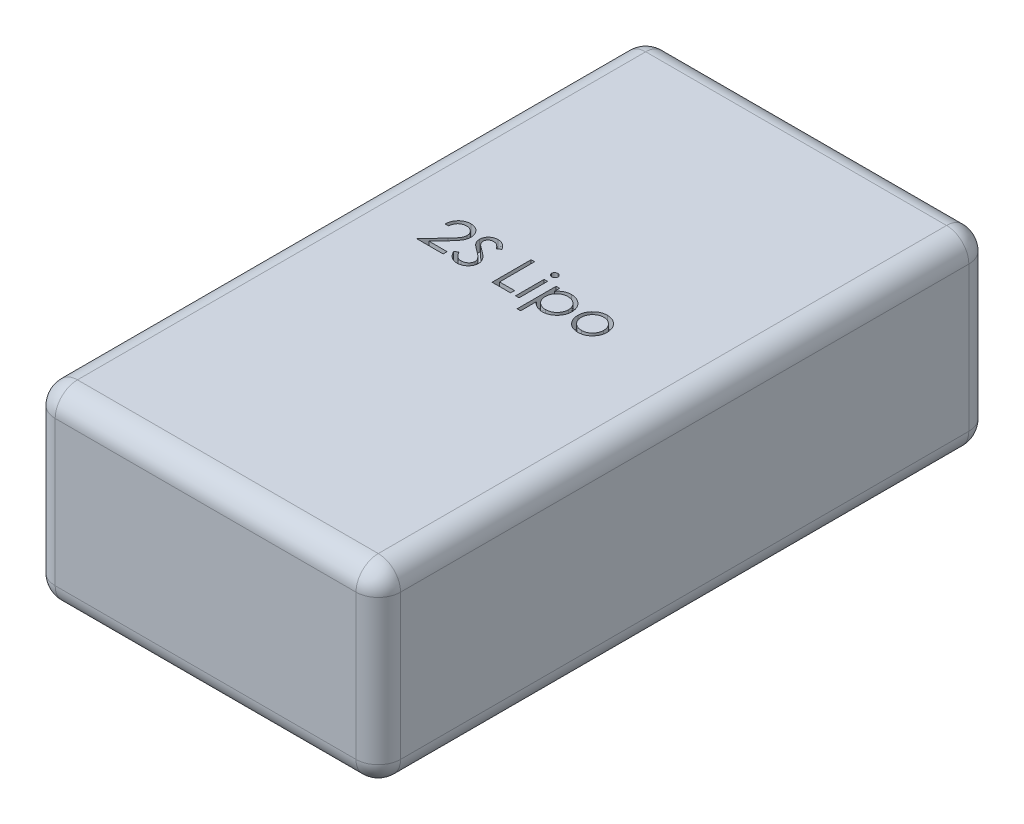
from build123d import *

# Parameters (mm, degrees)
SKETCH1_W           = 31
SKETCH1_H           = 55
BOSS_EXTRUDE1_DEPTH = 17
SKETCH2_W           = 0.314102564
SKETCH2_H           = 2.557692308
CUT_EXTRUDE1_DEPTH  = 1
FILLET1_R           = 2


with BuildPart() as part:
    # Sketch1 → Boss-Extrude1 (new body)
    with BuildSketch(Plane(origin=(0, 0, 0), x_dir=(1, 0, 0), z_dir=(0, 1, 0))):
        with Locations((15.5, -27.5)):
            Rectangle(SKETCH1_W, SKETCH1_H)
    extrude(amount=BOSS_EXTRUDE1_DEPTH)

    # Sketch2 → Cut-Extrude1 (cut)
    # profile 1 of 7: a face of its own
    with BuildSketch(Plane(origin=(0, 17, 0), x_dir=(1, 0, 0), z_dir=(0, 1, 0))):
        with BuildLine():
            Line((6.692234496, -24.382132974), (6.378131932, -24.382132974))
            add(Edge.make_bspline(
                [(6.378131932, -24.382132974), (6.380179085, -24.340462086), (6.384199639, -24.258621572), (6.403027928, -24.139297665), (6.429968806, -24.025242866), (6.46806026, -23.917372952), (6.515366537, -23.814734145), (6.572096565, -23.71773413), (6.639290415, -23.626742941), (6.715497149, -23.542604098), (6.798265788, -23.465416527), (6.887571728, -23.398761284), (6.981416755, -23.342443613), (7.079516154, -23.295362371), (7.182976718, -23.260022525), (7.290859576, -23.233800885), (7.403638712, -23.218024539), (7.480478734, -23.216328754), (7.519558214, -23.215466307)],
                knots=[0, 0, 0, 0, 1.10065271, 2.161652631, 3.183658789, 4.190468796, 5.17591951, 6.163126047, 7.15150782, 8.156236427, 9.156009102, 10.134482811, 11.092018607, 12.041330605, 13.001268258, 13.972401359, 14.968799086, 16, 16, 16, 16], degree=3))
            add(Edge.make_bspline(
                [(7.519558214, -23.215466307), (7.557936288, -23.216364764), (7.633347833, -23.218130198), (7.743409847, -23.233291228), (7.848187142, -23.257036819), (7.947474908, -23.290352236), (8.040480973, -23.335136663), (8.127904017, -23.388934202), (8.210784828, -23.451154033), (8.285391612, -23.524407847), (8.353899691, -23.602610231), (8.413001946, -23.686098135), (8.46361511, -23.77232742), (8.50580279, -23.861955622), (8.536858929, -23.95582665), (8.560437137, -24.052573853), (8.57376455, -24.153198664), (8.575809974, -24.22130522), (8.576849881, -24.255931051)],
                knots=[0, 0, 0, 0, 1.111607364, 2.184268762, 3.212621178, 4.221274766, 5.211760367, 6.196651075, 7.1921475, 8.207485113, 9.220403448, 10.201281604, 11.166441695, 12.114753415, 13.065576456, 14.026450734, 14.996634279, 16, 16, 16, 16], degree=3))
            add(Edge.make_bspline(
                [(8.576849881, -24.255931051), (8.575156618, -24.304678885), (8.571799807, -24.401319099), (8.54308543, -24.543333962), (8.498238919, -24.680927381), (8.444241562, -24.791664683), (8.389769118, -24.880898177), (8.34068161, -24.954366882), (8.283216799, -25.03347235), (8.216538301, -25.117949687), (8.142025429, -25.208460593), (8.059003266, -25.304950388), (7.966879784, -25.406422158), (7.902221283, -25.475727759), (7.868716868, -25.511640185)],
                knots=[0, 0, 0, 0, 1.184426356, 2.348067706, 3.509069118, 4.696110526, 5.333549288, 6.050745305, 6.844228056, 7.710549037, 8.667450064, 9.695053472, 10.805634456, 12, 12, 12, 12], degree=3))
            Line((7.868716868, -25.511640185), (6.993015746, -26.446235538))
            Line((6.993015746, -26.446235538), (8.621721676, -26.446235538))
            Line((8.621721676, -26.446235538), (8.621721676, -26.805209897))
            Line((8.621721676, -26.805209897), (6.243516548, -26.805209897))
            Line((6.243516548, -26.805209897), (7.600888342, -25.356692269))
            add(Edge.make_bspline(
                [(7.600888342, -25.356692269), (7.633936229, -25.322193962), (7.697414456, -25.255929776), (7.787197033, -25.159186815), (7.867836021, -25.069437275), (7.939853414, -24.986850726), (8.00168692, -24.910219158), (8.056559152, -24.842024455), (8.100524742, -24.779270005), (8.148240138, -24.706529391), (8.19445412, -24.617717073), (8.234166476, -24.509183384), (8.258381324, -24.397456132), (8.26128616, -24.321954095), (8.262747317, -24.283975923)],
                knots=[0, 0, 0, 0, 1.329631726, 2.553950428, 3.673215718, 4.687767853, 5.603093632, 6.413772471, 7.123043292, 7.734684054, 8.834405432, 9.900288307, 10.943827018, 12, 12, 12, 12], degree=3))
            add(Edge.make_bspline(
                [(8.262747317, -24.283975923), (8.262111574, -24.260094524), (8.260858648, -24.213028874), (8.249800951, -24.144023115), (8.233090445, -24.077458301), (8.209145187, -24.013129682), (8.177538447, -23.95168403), (8.139065067, -23.89304655), (8.094675003, -23.836357584), (8.043323734, -23.783204286), (7.986912214, -23.734523081), (7.927317965, -23.691398995), (7.86426786, -23.655359885), (7.798027738, -23.625816387), (7.728782269, -23.602641006), (7.656397524, -23.586582427), (7.581073507, -23.576499943), (7.529640012, -23.575135771), (7.503432413, -23.574440666)],
                knots=[0, 0, 0, 0, 0.991446411, 1.95395049, 2.89581595, 3.838931463, 4.798493298, 5.75982156, 6.748411868, 7.785213223, 8.824556874, 9.840280684, 10.836137867, 11.835679398, 12.848801643, 13.863922112, 14.911575587, 16, 16, 16, 16], degree=3))
            add(Edge.make_bspline(
                [(7.503432413, -23.574440666), (7.47606158, -23.575155698), (7.422309784, -23.576559904), (7.343390751, -23.586382568), (7.268104973, -23.603328408), (7.196263071, -23.626505083), (7.127743485, -23.655963631), (7.062879441, -23.692655376), (7.001816551, -23.736438869), (6.944440028, -23.786079426), (6.891576049, -23.841347027), (6.845129173, -23.90295699), (6.804545159, -23.969784405), (6.769135925, -24.041648956), (6.740380235, -24.119202736), (6.718407085, -24.202170441), (6.701020238, -24.290191822), (6.695211718, -24.350976907), (6.692234496, -24.382132974)],
                knots=[0, 0, 0, 0, 1.031018746, 2.02475058, 2.990194455, 3.934040569, 4.864654155, 5.795059489, 6.735614925, 7.690564532, 8.649604399, 9.611025574, 10.590972636, 11.591080095, 12.624614302, 13.701020113, 14.821632451, 16, 16, 16, 16], degree=3))
        make_face()
    # profile 2 of 7: a face of its own
    with BuildSketch(Plane(origin=(0, 17, 0), x_dir=(1, 0, 0), z_dir=(0, 1, 0))):
        with BuildLine():
            Line((8.890952445, -26.130029609), (9.186825842, -25.952645794))
            add(Edge.make_bspline(
                [(9.186825842, -25.952645794), (9.21434408, -25.998710179), (9.26706796, -26.086967763), (9.355019319, -26.206225804), (9.446152231, -26.30758796), (9.541141564, -26.390464568), (9.639407512, -26.455713455), (9.741591566, -26.501915686), (9.847349377, -26.530731662), (9.919323198, -26.534231748), (9.95525533, -26.535979128)],
                knots=[0, 0, 0, 0, 1.272034388, 2.437168799, 3.508375237, 4.49857839, 5.41946034, 6.295179144, 7.148887113, 8, 8, 8, 8], degree=3))
            add(Edge.make_bspline(
                [(9.95525533, -26.535979128), (9.98594219, -26.535124455), (10.046778963, -26.533430065), (10.136341206, -26.517149263), (10.223323008, -26.492137134), (10.305931646, -26.456316202), (10.383027261, -26.412977717), (10.450633956, -26.360631539), (10.509080069, -26.302025334), (10.556889184, -26.236642679), (10.593569219, -26.16632553), (10.621761287, -26.094149579), (10.637406361, -26.018981011), (10.639763115, -25.968370548), (10.640952445, -25.942830089)],
                knots=[0, 0, 0, 0, 1.095163259, 2.171163733, 3.241058638, 4.321873601, 5.38011039, 6.391990106, 7.366004449, 8.327778327, 9.272591725, 10.192022065, 11.087607919, 12, 12, 12, 12], degree=3))
            add(Edge.make_bspline(
                [(10.640952445, -25.942830089), (10.639478134, -25.91368924), (10.636481076, -25.85445015), (10.611149596, -25.767050497), (10.571300349, -25.680557927), (10.534537705, -25.627056662), (10.515451644, -25.59928041)],
                knots=[0, 0, 0, 0, 0.938893495, 1.908633276, 2.914225137, 4, 4, 4, 4], degree=3))
            add(Edge.make_bspline(
                [(10.515451644, -25.59928041), (10.499781029, -25.579233586), (10.466882535, -25.537147788), (10.410325023, -25.474502552), (10.343958908, -25.409884133), (10.270055353, -25.340825076), (10.185922265, -25.27053728), (10.09419475, -25.195669002), (9.992530891, -25.119067425), (9.921231395, -25.067694859), (9.884442028, -25.041187461)],
                knots=[0, 0, 0, 0, 0.722233717, 1.516239348, 2.393582979, 3.351407094, 4.387010283, 5.505090956, 6.712668013, 8, 8, 8, 8], degree=3))
            add(Edge.make_bspline(
                [(9.884442028, -25.041187461), (9.847618032, -25.014958873), (9.777213356, -24.964811811), (9.678754773, -24.890387527), (9.59071031, -24.822343658), (9.513471294, -24.760039646), (9.447071697, -24.703467041), (9.390988286, -24.653169102), (9.346649729, -24.607785541), (9.321994148, -24.578344199), (9.3109244, -24.565125762)],
                knots=[0, 0, 0, 0, 1.452282411, 2.77665338, 3.964542531, 5.026858415, 5.96415736, 6.766646006, 7.446254459, 8, 8, 8, 8], degree=3))
            add(Edge.make_bspline(
                [(9.3109244, -24.565125762), (9.295451855, -24.544524725), (9.265023018, -24.504010022), (9.224857013, -24.440685164), (9.19071785, -24.375861899), (9.163955518, -24.309366034), (9.141419299, -24.242131105), (9.126261368, -24.173279859), (9.116769971, -24.103121241), (9.115797985, -24.05590774), (9.115311419, -24.032273198)],
                knots=[0, 0, 0, 0, 1.068054152, 2.10047183, 3.106115577, 4.101338837, 5.06977816, 6.043150881, 7.020423561, 8, 8, 8, 8], degree=3))
            add(Edge.make_bspline(
                [(9.115311419, -24.032273198), (9.116616628, -23.995243424), (9.119199148, -23.92197536), (9.141039666, -23.81494453), (9.175512559, -23.712758112), (9.223807447, -23.616427779), (9.2860648, -23.528461798), (9.358110774, -23.447848311), (9.443922261, -23.380079728), (9.538074884, -23.32086767), (9.641131256, -23.274521745), (9.749122159, -23.239560765), (9.862219231, -23.219751507), (9.938822366, -23.216908742), (9.977691227, -23.215466307)],
                knots=[0, 0, 0, 0, 1.005424448, 1.989358655, 2.955360095, 3.929531133, 4.905563448, 5.876582895, 6.856512386, 7.866279853, 8.892233794, 9.918561126, 10.94386622, 12, 12, 12, 12], degree=3))
            add(Edge.make_bspline(
                [(9.977691227, -23.215466307), (10.018935327, -23.216888859), (10.100956679, -23.21971786), (10.221605895, -23.244315391), (10.337766611, -23.285016063), (10.431209876, -23.331204721), (10.504342637, -23.377336137), (10.56011537, -23.419355961), (10.616632821, -23.46773107), (10.674350876, -23.522590316), (10.732291535, -23.584437067), (10.791314987, -23.652847756), (10.851559256, -23.727404312), (10.890315116, -23.780628812), (10.910183214, -23.807914224)],
                knots=[0, 0, 0, 0, 1.286793592, 2.559021753, 3.825965368, 5.121522368, 5.803751409, 6.523245864, 7.299691795, 8.125521123, 9.008227632, 9.944561021, 10.946284179, 12, 12, 12, 12], degree=3))
            Line((10.910183214, -23.807914224), (10.626228887, -24.023158615))
            add(Edge.make_bspline(
                [(10.626228887, -24.023158615), (10.609082955, -24.001069924), (10.576063898, -23.958532271), (10.525934411, -23.898960956), (10.478685763, -23.844544476), (10.432135363, -23.797279348), (10.388741732, -23.754577215), (10.346624689, -23.718017458), (10.306390338, -23.687241863), (10.255673428, -23.654398303), (10.191955709, -23.621841799), (10.111971173, -23.594292721), (10.028384898, -23.577737659), (9.971455266, -23.575548771), (9.942635137, -23.574440666)],
                knots=[0, 0, 0, 0, 1.181633172, 2.275549214, 3.290209073, 4.226197932, 5.078386478, 5.862611352, 6.581680152, 7.217281963, 8.414376989, 9.595101626, 10.782541182, 12, 12, 12, 12], degree=3))
            add(Edge.make_bspline(
                [(9.942635137, -23.574440666), (9.906478615, -23.575652366), (9.836754167, -23.577989015), (9.737763931, -23.603509001), (9.648670006, -23.643690861), (9.572117441, -23.700005839), (9.508380464, -23.766726832), (9.462275005, -23.843505687), (9.434524841, -23.928288089), (9.431138561, -23.987429746), (9.429413983, -24.017549641)],
                knots=[0, 0, 0, 0, 1.14458467, 2.207223713, 3.21896685, 4.227309161, 5.202851033, 6.127160689, 7.046193047, 8, 8, 8, 8], degree=3))
            add(Edge.make_bspline(
                [(9.429413983, -24.017549641), (9.42980711, -24.036301119), (9.430594006, -24.073834739), (9.441568804, -24.12928616), (9.455668133, -24.1845975), (9.478010765, -24.239520083), (9.508856068, -24.295014442), (9.549361244, -24.352036179), (9.600374556, -24.411087888), (9.639451568, -24.449495262), (9.660083054, -24.469773198)],
                knots=[0, 0, 0, 0, 0.858281714, 1.717966888, 2.583508476, 3.4729293, 4.427298488, 5.488583878, 6.674047936, 8, 8, 8, 8], degree=3))
            add(Edge.make_bspline(
                [(9.660083054, -24.469773198), (9.667744426, -24.476610224), (9.685946093, -24.492853432), (9.719222019, -24.519445713), (9.763164817, -24.552248485), (9.816627019, -24.592835802), (9.88059438, -24.639917264), (9.955073936, -24.692890876), (10.039235469, -24.753476335), (10.098957385, -24.795833876), (10.130535778, -24.81823073)],
                knots=[0, 0, 0, 0, 0.420754252, 0.999615792, 1.744751191, 2.668019286, 3.750313428, 4.999500688, 6.413464383, 8, 8, 8, 8], degree=3))
            add(Edge.make_bspline(
                [(10.130535778, -24.81823073), (10.168521692, -24.84587209), (10.242076148, -24.899395752), (10.346733728, -24.979811432), (10.441627536, -25.0584592), (10.52709074, -25.134836807), (10.603967648, -25.2083649), (10.671405369, -25.279928081), (10.730091049, -25.349013653), (10.793270267, -25.437586229), (10.857828087, -25.546367313), (10.913269594, -25.679645552), (10.948227942, -25.813441872), (10.952799457, -25.903368709), (10.955055009, -25.947737942)],
                knots=[0, 0, 0, 0, 1.163667725, 2.253281268, 3.268753668, 4.215851969, 5.092017293, 5.902905408, 6.650798638, 7.335211899, 8.59617414, 9.77448103, 10.901945474, 12, 12, 12, 12], degree=3))
            add(Edge.make_bspline(
                [(10.955055009, -25.947737942), (10.954397871, -25.979116307), (10.953096356, -26.04126369), (10.938135442, -26.132518767), (10.916215777, -26.221149637), (10.883178543, -26.306060749), (10.842855385, -26.388805512), (10.791689137, -26.467213413), (10.732381452, -26.543019811), (10.664347687, -26.614203303), (10.589901785, -26.679549499), (10.51121809, -26.73767856), (10.428167817, -26.786146883), (10.341201501, -26.825697725), (10.250299164, -26.856631243), (10.15549138, -26.879044112), (10.056621869, -26.892799823), (9.989421387, -26.894227584), (9.95525533, -26.894953487)],
                knots=[0, 0, 0, 0, 0.983748083, 1.948392443, 2.894712957, 3.844097841, 4.80183111, 5.778335162, 6.776009319, 7.81870978, 8.863265674, 9.881300176, 10.883814829, 11.87499822, 12.874611388, 13.892143829, 14.928324115, 16, 16, 16, 16], degree=3))
            add(Edge.make_bspline(
                [(9.95525533, -26.894953487), (9.928819987, -26.894442305), (9.876282227, -26.89342638), (9.798572745, -26.884445099), (9.722433155, -26.871737996), (9.648818873, -26.851563926), (9.576781462, -26.827086949), (9.506634227, -26.796948616), (9.438343173, -26.760831415), (9.371525591, -26.71953639), (9.306351416, -26.671478645), (9.243431948, -26.615505149), (9.180702762, -26.553159644), (9.120015366, -26.482749081), (9.060142222, -26.405410998), (9.002263812, -26.320421814), (8.945182095, -26.228244461), (8.909366627, -26.163379375), (8.890952445, -26.130029609)],
                knots=[0, 0, 0, 0, 0.915332311, 1.819136955, 2.706846663, 3.586547465, 4.459518054, 5.340707479, 6.227863349, 7.133153174, 8.059268498, 9.028702269, 10.047606654, 11.120612155, 12.245963614, 13.433783089, 14.680604001, 16, 16, 16, 16], degree=3))
        make_face()
    # profile 3 of 7: a face of its own
    with BuildSketch(Plane(origin=(0, 17, 0), x_dir=(1, 0, 0), z_dir=(0, 1, 0))):
        Polygon((13.019157573, -23.305209897), (13.333260137, -23.305209897), (13.333260137, -26.446235538), (14.679413983, -26.446235538), (14.679413983, -26.805209897), (13.019157573, -26.805209897), align=None)
    # profile 4 of 7: a face of its own
    with BuildSketch(Plane(origin=(0, 17, 0), x_dir=(1, 0, 0), z_dir=(0, 1, 0))):
        with BuildLine():
            add(Edge.make_bspline(
                [(15.283780971, -23.170594512), (15.303272286, -23.171498665), (15.341440026, -23.173269169), (15.396633294, -23.188430646), (15.446890306, -23.214130331), (15.491468039, -23.248610012), (15.529719926, -23.289159456), (15.556500636, -23.336420424), (15.573713032, -23.387479063), (15.575791587, -23.423094152), (15.576849881, -23.441227525)],
                knots=[0, 0, 0, 0, 1.055194115, 2.066272739, 3.074728998, 4.095836921, 5.109056067, 6.073838105, 7.019297344, 8, 8, 8, 8], degree=3))
            add(Edge.make_bspline(
                [(15.576849881, -23.441227525), (15.575767721, -23.458890178), (15.573628419, -23.493807153), (15.556513931, -23.543980625), (15.529491693, -23.590584909), (15.491492567, -23.631055619), (15.446883806, -23.665516239), (15.396635021, -23.691220978), (15.341439572, -23.706381115), (15.303272133, -23.708151804), (15.283780971, -23.709056051)],
                knots=[0, 0, 0, 0, 0.96129708, 1.900370562, 2.859976407, 3.87933698, 4.906634145, 5.921202961, 6.938410037, 8, 8, 8, 8], degree=3))
            add(Edge.make_bspline(
                [(15.283780971, -23.709056051), (15.264512695, -23.708186331), (15.227009515, -23.706493534), (15.172642673, -23.690923516), (15.122814184, -23.665507443), (15.078149511, -23.631281258), (15.040919318, -23.590336361), (15.013820992, -23.544009067), (14.99674603, -23.493799912), (14.994601402, -23.458887746), (14.993516548, -23.441227525)],
                knots=[0, 0, 0, 0, 1.054934014, 2.053291228, 3.073705704, 4.106921865, 5.123545215, 6.088680038, 7.033164197, 8, 8, 8, 8], degree=3))
            add(Edge.make_bspline(
                [(14.993516548, -23.441227525), (14.994577634, -23.423096676), (14.996661675, -23.387486543), (15.013833791, -23.33639151), (15.040693599, -23.289410008), (15.078174163, -23.248384509), (15.122807623, -23.214139074), (15.172644368, -23.188728093), (15.227009067, -23.173156753), (15.264512543, -23.171464139), (15.283780971, -23.170594512)],
                knots=[0, 0, 0, 0, 0.98631895, 1.937192651, 2.907499808, 3.917963147, 4.944918757, 5.95915025, 6.951458133, 8, 8, 8, 8], degree=3))
        make_face()
    # profile 5 of 7: a face of its own
    with BuildSketch(Plane(origin=(0, 17, 0), x_dir=(1, 0, 0), z_dir=(0, 1, 0))):
        with Locations((15.285183214, -25.526363743)):
            Rectangle(SKETCH2_W, SKETCH2_H)
    # profile 6 of 7: a face of its own
    with BuildSketch(Plane(origin=(0, 17, 0), x_dir=(1, 0, 0), z_dir=(0, 1, 0))):
        with BuildLine():
            Line((16.205055009, -24.247517589), (16.519157573, -24.247517589))
            Line((16.519157573, -24.247517589), (16.519157573, -24.720774801))
            add(Edge.make_bspline(
                [(16.519157573, -24.720774801), (16.552515057, -24.677837067), (16.617338652, -24.594396174), (16.729063557, -24.486406045), (16.846990366, -24.395330742), (16.974153778, -24.323948209), (17.108577468, -24.270127397), (17.249709786, -24.230347947), (17.398748551, -24.206906472), (17.500645003, -24.204084811), (17.552611099, -24.202645794)],
                knots=[0, 0, 0, 0, 1.0828784, 2.104357462, 3.088488658, 4.04616522, 5.001424249, 5.969181776, 6.964304535, 8, 8, 8, 8], degree=3))
            add(Edge.make_bspline(
                [(17.552611099, -24.202645794), (17.598002702, -24.203958973), (17.68772159, -24.20655454), (17.819784819, -24.224127595), (17.946960203, -24.254245287), (18.068528257, -24.297646203), (18.185791322, -24.351301673), (18.297013422, -24.419018708), (18.403926977, -24.497424899), (18.503843166, -24.58765705), (18.596164534, -24.685285316), (18.676010715, -24.79030762), (18.744882619, -24.899270207), (18.800552916, -25.013862299), (18.844161263, -25.133181529), (18.875175941, -25.25770997), (18.893633584, -25.38698591), (18.896110036, -25.474888631), (18.897362701, -25.519352525)],
                knots=[0, 0, 0, 0, 1.041296284, 2.058176809, 3.050446431, 4.034000596, 5.01514041, 6.003636468, 7.015969324, 8.052561599, 9.08815499, 10.094063707, 11.074456064, 12.040834395, 13.011057502, 13.983766392, 14.980127149, 16, 16, 16, 16], degree=3))
            add(Edge.make_bspline(
                [(18.897362701, -25.519352525), (18.896137216, -25.564754834), (18.893720381, -25.654294738), (18.874975375, -25.785781835), (18.845018501, -25.912269209), (18.801960318, -26.033546473), (18.74631883, -26.149530124), (18.67861427, -26.26013652), (18.598727802, -26.365330223), (18.507426675, -26.463683123), (18.408373739, -26.554282436), (18.302496249, -26.633520506), (18.191437324, -26.700061881), (18.075765156, -26.755644841), (17.954489518, -26.797537025), (17.82817624, -26.827754826), (17.696894094, -26.846389321), (17.607592942, -26.848841464), (17.562426804, -26.850081692)],
                knots=[0, 0, 0, 0, 1.038740735, 2.04854663, 3.033179607, 4.009277356, 4.987731542, 5.972001279, 6.972200261, 8.005528982, 9.039189865, 10.040446548, 11.026516639, 11.997840187, 12.972163198, 13.956796175, 14.96660207, 16, 16, 16, 16], degree=3))
            add(Edge.make_bspline(
                [(17.562426804, -26.850081692), (17.511599232, -26.848786884), (17.411199876, -26.846229259), (17.264402205, -26.820309849), (17.123125354, -26.781572914), (16.988934529, -26.72487392), (16.860766716, -26.652618404), (16.739346911, -26.564508198), (16.624030158, -26.460727573), (16.5546214, -26.381995757), (16.519157573, -26.341768391)],
                knots=[0, 0, 0, 0, 1.014726462, 2.004382257, 2.969841629, 3.936926163, 4.907207904, 5.903978561, 6.929055279, 8, 8, 8, 8], degree=3))
            Line((16.519157573, -26.341768391), (16.519157573, -27.747517589))
            Line((16.519157573, -27.747517589), (16.205055009, -27.747517589))
            Line((16.205055009, -27.747517589), (16.205055009, -24.247517589))
        make_face()
        with BuildLine():
            add(Edge.make_bspline(
                [(17.549806612, -24.516748359), (17.514227049, -24.517388617), (17.444180061, -24.51864912), (17.341507842, -24.533623069), (17.242612415, -24.55536081), (17.148490463, -24.58827271), (17.058239847, -24.628671524), (16.972555682, -24.679153535), (16.891498114, -24.738805541), (16.815271084, -24.806484884), (16.746407791, -24.881059573), (16.685444863, -24.960647382), (16.634237557, -25.045147521), (16.591735537, -25.133772884), (16.559392255, -25.227218169), (16.536436535, -25.324951182), (16.522006182, -25.427078894), (16.520117245, -25.496634901), (16.519157573, -25.531972717)],
                knots=[0, 0, 0, 0, 1.05670511, 2.080379991, 3.077984906, 4.06214886, 5.038337365, 6.01289324, 7.01187578, 8.025460281, 9.038092164, 10.024533457, 11.000252242, 11.969694649, 12.940728589, 13.933144304, 14.949937299, 16, 16, 16, 16], degree=3))
            add(Edge.make_bspline(
                [(16.519157573, -25.531972717), (16.520748429, -25.57836083), (16.523865051, -25.669239071), (16.549202419, -25.802023193), (16.590437683, -25.927674849), (16.648966397, -26.045135886), (16.722913971, -26.153118721), (16.812012127, -26.249809327), (16.915454678, -26.334599918), (17.03152187, -26.406021172), (17.155944001, -26.464009238), (17.285729913, -26.505523449), (17.419094794, -26.531095677), (17.509263113, -26.534342496), (17.554714464, -26.535979128)],
                knots=[0, 0, 0, 0, 1.03728447, 2.032128127, 3.01272805, 3.987917167, 4.958271349, 5.931593992, 6.91984656, 7.941419022, 8.973179163, 9.983609215, 10.983593296, 12, 12, 12, 12], degree=3))
            add(Edge.make_bspline(
                [(17.554714464, -26.535979128), (17.599250232, -26.534422751), (17.687645725, -26.531333623), (17.817803847, -26.504595435), (17.944294485, -26.46375041), (18.064474657, -26.404190854), (18.177298145, -26.331200796), (18.279179699, -26.243640763), (18.368186612, -26.14215082), (18.444050967, -26.029142317), (18.505182453, -25.907966933), (18.551112693, -25.782585544), (18.577621266, -25.653440121), (18.581378054, -25.566442408), (18.583260137, -25.522858134)],
                knots=[0, 0, 0, 0, 1.00104056, 1.986885549, 2.97790532, 3.984399681, 4.995088187, 5.994304198, 6.996462723, 8.023150851, 9.048424203, 10.043036403, 11.019596776, 12, 12, 12, 12], degree=3))
            add(Edge.make_bspline(
                [(18.583260137, -25.522858134), (18.581805403, -25.479003145), (18.57890727, -25.391634841), (18.550360232, -25.262871938), (18.507460254, -25.136983962), (18.444901202, -25.017463413), (18.370699933, -24.90468933), (18.280952936, -24.805135451), (18.180336739, -24.717964778), (18.067647575, -24.645949368), (17.94670715, -24.588663873), (17.819392234, -24.546780234), (17.686348632, -24.521606485), (17.595720977, -24.518381979), (17.549806612, -24.516748359)],
                knots=[0, 0, 0, 0, 0.983928682, 1.960191568, 2.949917689, 3.96440592, 4.982380491, 5.975291189, 6.965713506, 7.964880129, 8.970154049, 9.96478489, 10.968906225, 12, 12, 12, 12], degree=3))
        make_face(mode=Mode.SUBTRACT)
    # profile 7 of 7: a face of its own
    with BuildSketch(Plane(origin=(0, 17, 0), x_dir=(1, 0, 0), z_dir=(0, 1, 0))):
        with BuildLine():
            add(Edge.make_bspline(
                [(20.760944432, -24.202645794), (20.808935705, -24.203667686), (20.903034863, -24.205671364), (21.040842748, -24.22708633), (21.172387884, -24.259833694), (21.298174077, -24.305105256), (21.416590372, -24.365787207), (21.529361616, -24.438196498), (21.636178625, -24.523979092), (21.700201654, -24.59033716), (21.73269924, -24.624019993)],
                knots=[0, 0, 0, 0, 1.054011418, 2.066658804, 3.057071809, 4.030435133, 4.997543892, 5.974964718, 6.972108034, 8, 8, 8, 8], degree=3))
            add(Edge.make_bspline(
                [(21.73269924, -24.624019993), (21.760681194, -24.656233979), (21.816103574, -24.720038521), (21.887169293, -24.823494134), (21.948390853, -24.930634235), (21.997453814, -25.042881561), (22.036138838, -25.159256233), (22.063604534, -25.280158244), (22.079941469, -25.405320591), (22.082144436, -25.490324429), (22.083260137, -25.533374961)],
                knots=[0, 0, 0, 0, 1.025258237, 2.030674902, 3.01204498, 3.988269485, 4.97094183, 5.956517959, 6.965070386, 8, 8, 8, 8], degree=3))
            add(Edge.make_bspline(
                [(22.083260137, -25.533374961), (22.0822788, -25.576675019), (22.080339632, -25.662237952), (22.061996015, -25.788257318), (22.033464929, -25.910452141), (21.992633091, -26.028310834), (21.940274982, -26.142193662), (21.876384294, -26.251603211), (21.800512677, -26.356755344), (21.71450868, -26.456757183), (21.619456804, -26.548923397), (21.516340656, -26.629251667), (21.407186622, -26.698073191), (21.290543269, -26.753509607), (21.167475782, -26.797219307), (21.037718714, -26.827919324), (20.901473644, -26.846481007), (20.808446422, -26.848864581), (20.760944432, -26.850081692)],
                knots=[0, 0, 0, 0, 0.998656419, 1.973391657, 2.932242238, 3.890759089, 4.846373663, 5.82037756, 6.809684879, 7.83454468, 8.860553229, 9.859544525, 10.845671541, 11.83227036, 12.833544569, 13.85385346, 14.904124723, 16, 16, 16, 16], degree=3))
            add(Edge.make_bspline(
                [(20.760944432, -26.850081692), (20.713209713, -26.848860496), (20.619718853, -26.846468721), (20.482992871, -26.827991438), (20.353003252, -26.797233456), (20.229774654, -26.753365963), (20.112629807, -26.698071419), (20.00284331, -26.62945973), (19.899643394, -26.548899575), (19.80457141, -26.456763637), (19.718572804, -26.356753681), (19.642699796, -26.251603643), (19.57880947, -26.142193549), (19.526451266, -26.028310864), (19.485619453, -25.910452132), (19.45708836, -25.78825732), (19.438744746, -25.662237952), (19.436805577, -25.576675019), (19.43582424, -25.533374961)],
                knots=[0, 0, 0, 0, 1.099876186, 2.154163076, 3.173186993, 4.173200201, 5.163417411, 6.152872554, 7.150605724, 8.17532212, 9.198891216, 10.186952605, 11.159729845, 12.11414092, 13.071450619, 14.029093627, 15.002601286, 16, 16, 16, 16], degree=3))
            add(Edge.make_bspline(
                [(19.43582424, -25.533374961), (19.43694755, -25.490558415), (19.439171512, -25.405789013), (19.455492021, -25.280861952), (19.482850577, -25.160164563), (19.521581974, -25.044239087), (19.571097165, -24.932483651), (19.631458452, -24.82507882), (19.703249085, -24.72209102), (19.758451037, -24.65836894), (19.786385137, -24.626123359)],
                knots=[0, 0, 0, 0, 1.031353054, 2.041901799, 3.029428768, 4.008703097, 4.981709435, 5.96992636, 6.972712378, 8, 8, 8, 8], degree=3))
            add(Edge.make_bspline(
                [(19.786385137, -24.626123359), (19.818833728, -24.592148419), (19.882649592, -24.525330723), (19.98999832, -24.439798199), (20.102492141, -24.365882125), (20.222217067, -24.30640591), (20.347899925, -24.259567392), (20.480119168, -24.227001877), (20.618394683, -24.205748522), (20.712954304, -24.203690344), (20.760944432, -24.202645794)],
                knots=[0, 0, 0, 0, 1.027980169, 2.021703884, 2.998553061, 3.971491411, 4.943284454, 5.930300938, 6.949603206, 8, 8, 8, 8], degree=3))
        make_face()
        with BuildLine():
            add(Edge.make_bspline(
                [(20.759542189, -24.516748359), (20.725604577, -24.51771295), (20.658605449, -24.519617233), (20.559985864, -24.534101137), (20.46504571, -24.557048642), (20.373604866, -24.589652698), (20.285971693, -24.631751597), (20.202062291, -24.683459957), (20.121629851, -24.744092913), (20.046247788, -24.813555585), (19.977065476, -24.88943458), (19.916587499, -24.970282938), (19.865162393, -25.054789285), (19.822322234, -25.143041496), (19.790415046, -25.23593391), (19.767242023, -25.332414541), (19.752771783, -25.432679957), (19.750885404, -25.500840976), (19.749926804, -25.535478326)],
                knots=[0, 0, 0, 0, 1.021534396, 2.016698045, 2.994645724, 3.958388632, 4.93408049, 5.916473867, 6.921342795, 7.962252576, 8.998418191, 10.008913653, 10.997312074, 11.973003931, 12.956656626, 13.948281152, 14.957379055, 16, 16, 16, 16], degree=3))
            add(Edge.make_bspline(
                [(19.749926804, -25.535478326), (19.751533628, -25.580230354), (19.754722872, -25.669054759), (19.780658108, -25.799865882), (19.824044388, -25.925447734), (19.882631668, -26.04506412), (19.956037887, -26.155736398), (20.042524953, -26.254407882), (20.141164654, -26.339593694), (20.250781154, -26.410274539), (20.369135472, -26.466434295), (20.494391793, -26.506233271), (20.625032487, -26.532104963), (20.714313218, -26.534676437), (20.759542189, -26.535979128)],
                knots=[0, 0, 0, 0, 1.016792936, 2.018143844, 3.017858371, 4.030088057, 5.03801393, 6.028138512, 7.003788237, 7.991172063, 8.984598303, 9.972568034, 10.972917682, 12, 12, 12, 12], degree=3))
            add(Edge.make_bspline(
                [(20.759542189, -26.535979128), (20.804768557, -26.534668847), (20.894044153, -26.532082391), (21.02450333, -26.506363571), (21.149417302, -26.46625991), (21.26764869, -26.4103377), (21.377215293, -26.339325286), (21.476564414, -26.254888908), (21.562313026, -26.155475057), (21.63564663, -26.044917528), (21.695193373, -25.925633176), (21.738376575, -25.799842704), (21.764374161, -25.669060662), (21.76755499, -25.580232331), (21.769157573, -25.535478326)],
                knots=[0, 0, 0, 0, 1.02726834, 2.027799167, 3.010890988, 4.004497153, 4.992059811, 5.971914811, 6.958719428, 7.966827853, 8.981595046, 9.981490638, 10.983022906, 12, 12, 12, 12], degree=3))
            add(Edge.make_bspline(
                [(21.769157573, -25.535478326), (21.768199303, -25.500840769), (21.766313574, -25.432679343), (21.75183861, -25.332416889), (21.72868307, -25.235925293), (21.696711453, -25.14307329), (21.654057439, -25.054560785), (21.601640646, -24.970531058), (21.54140962, -24.889154512), (21.471392499, -24.813800871), (21.396089122, -24.744065835), (21.315624083, -24.683436445), (21.231839105, -24.63197885), (21.144460522, -24.589292609), (21.053007955, -24.557345269), (20.958200825, -24.533968637), (20.860002015, -24.519678441), (20.793242972, -24.517731299), (20.759542189, -24.516748359)],
                knots=[0, 0, 0, 0, 1.042956736, 2.052379634, 3.044323526, 4.02829302, 5.004299113, 5.996692471, 7.007513377, 8.048758398, 9.090003419, 10.095195979, 11.07790575, 12.047570684, 13.018257071, 13.989683339, 14.985167495, 16, 16, 16, 16], degree=3))
        make_face(mode=Mode.SUBTRACT)
    extrude(amount=-CUT_EXTRUDE1_DEPTH, mode=Mode.SUBTRACT)

    # Fillet1
    fillet1_edges = [part.edges().sort_by_distance(p)[0] for p in [
        (15.5, 17, 55),
        (15.5, 0, 55),
        (0, 0, 27.5),
        (31, 0, 27.5),
        (0, 17, 27.5),
        (31, 17, 27.5),
        (15.5, 0, 0),
        (15.5, 17, 0),
        (0, 8.5, 0),
        (31, 8.5, 0),
        (31, 8.5, 55),
        (0, 8.5, 55),
    ]]
    fillet(fillet1_edges, radius=FILLET1_R)


solid = part.part
